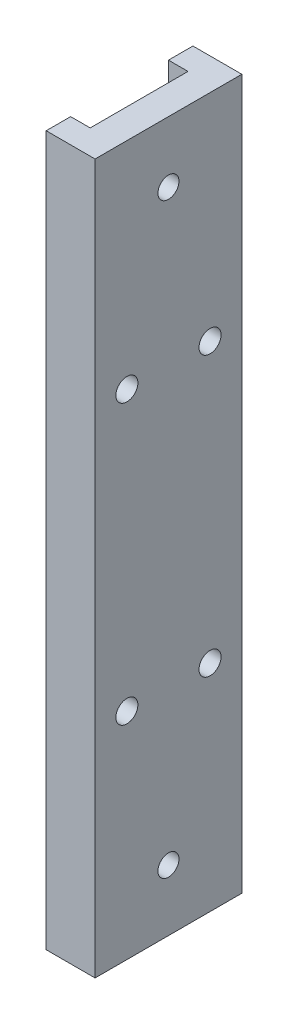
from build123d import *

# Parameters (mm, degrees)
BOSS_EXTRUDE1_DEPTH  = 145
M4_CLEARANCE_HOLE1_D = 4.3
HOLE1_D              = 4.5
HOLE1_DEPTH          = 6


with BuildPart() as part:
    # Sketch1 → Boss-Extrude1 (new body)
    with BuildSketch(Plane(origin=(0, 260, 0), x_dir=(-1, 0, 0), z_dir=(0, -1, 0))):
        Polygon((71.5, -127.5), (61.5, -127.5), (61.5, -97.5), (71.5, -97.5), (71.5, -102.5), (67.5, -102.5), (67.5, -122.5), (71.5, -122.5), align=None)
    extrude(amount=BOSS_EXTRUDE1_DEPTH)

    # M4 Clearance Hole1 (through all)
    with Locations(Plane(origin=(-61.5, 0, 0), x_dir=(0, 0, -1), z_dir=(1, 0, 0))):
        with Locations((-112.5, 247.5), (-112.5, 127.5)):
            Hole(M4_CLEARANCE_HOLE1_D / 2)

    # Hole1
    with Locations(Plane(origin=(-61.5, 0, 0), x_dir=(0, 0, -1), z_dir=(1, 0, 0))):
        with Locations((-104, 216), (-121, 216), (-104, 159), (-121, 159)):
            Hole(HOLE1_D / 2, depth=HOLE1_DEPTH)


solid = part.part
